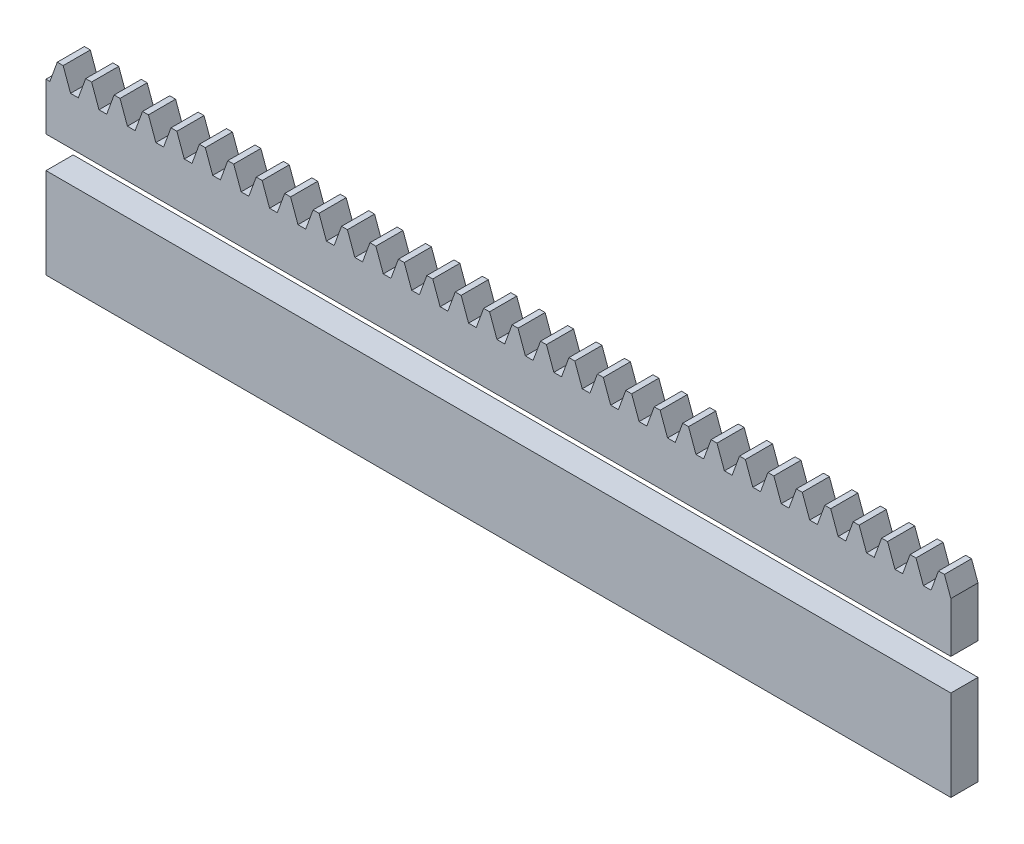
from build123d import *

# Parameters (mm, degrees)
DODANIE_WYCI_GNI_CIE1_DEPTH = 12
WYTNIJ_WYCI_GNI_CIE1_REACH  = 404.592
SZKIC3_W                    = 400
SZKIC3_H                    = 14
SZKIC2_W                    = 400
SZKIC2_H                    = 12
DODANIE_WYCI_GNI_CIE2_DEPTH = 40


with BuildPart() as part:
    # Szkic1 → Dodanie-wyciągnięcie1 (new body)
    with BuildSketch(Plane.XY):
        Polygon((400, 0), (400, 36.15701143), (397.145385613, 44), (394.535962187, 44), (391.260230079, 35), (387.854747121, 35), (384.579015013, 44), (381.969591587, 44), (378.693859479, 35), (375.288376521, 35), (372.012644413, 44), (369.403220987, 44), (366.127488879, 35), (362.722005921, 35), (359.446273813, 44), (356.836850387, 44), (353.561118279, 35), (350.155635321, 35), (346.879903213, 44), (344.270479787, 44), (340.994747679, 35), (337.589264721, 35), (334.313532613, 44), (331.704109187, 44), (328.428377079, 35), (325.022894121, 35), (321.747162013, 44), (319.137738587, 44), (315.862006479, 35), (312.456523521, 35), (309.180791413, 44), (306.571367987, 44), (303.295635879, 35), (299.890152921, 35), (296.614420813, 44), (294.004997387, 44), (290.729265279, 35), (287.323782321, 35), (284.048050213, 44), (281.438626787, 44), (278.162894679, 35), (274.757411721, 35), (271.481679613, 44), (268.872256187, 44), (265.596524079, 35), (262.191041121, 35), (258.915309013, 44), (256.305885587, 44), (253.030153479, 35), (249.624670521, 35), (246.348938413, 44), (243.739514987, 44), (240.463782879, 35), (237.058299921, 35), (233.782567813, 44), (231.173144387, 44), (227.897412279, 35), (224.491929321, 35), (221.216197213, 44), (218.606773787, 44), (215.331041679, 35), (211.925558721, 35), (208.649826613, 44), (206.040403187, 44), (202.764671079, 35), (199.359188121, 35), (196.083456013, 44), (193.474032587, 44), (190.198300479, 35), (186.792817521, 35), (183.517085413, 44), (180.907661987, 44), (177.631929879, 35), (174.226446921, 35), (170.950714813, 44), (168.341291387, 44), (165.065559279, 35), (161.660076321, 35), (158.384344213, 44), (155.774920787, 44), (152.499188679, 35), (149.093705721, 35), (145.817973613, 44), (143.208550187, 44), (139.932818079, 35), (136.527335121, 35), (133.251603013, 44), (130.642179587, 44), (127.366447479, 35), (123.960964521, 35), (120.685232413, 44), (118.075808987, 44), (114.800076879, 35), (111.394593921, 35), (108.118861813, 44), (105.509438387, 44), (102.233706279, 35), (98.828223321, 35), (95.552491213, 44), (92.943067787, 44), (89.667335679, 35), (86.261852721, 35), (82.986120613, 44), (80.376697187, 44), (77.100965079, 35), (73.695482121, 35), (70.419750013, 44), (67.810326587, 44), (64.534594479, 35), (61.129111521, 35), (57.853379413, 44), (55.243955987, 44), (51.968223879, 35), (48.562740921, 35), (45.287008813, 44), (42.677585387, 44), (39.401853279, 35), (35.996370321, 35), (32.720638213, 44), (30.111214787, 44), (26.835482679, 35), (23.429999721, 35), (20.154267613, 44), (17.544844187, 44), (14.269112079, 35), (10.863629121, 35), (7.587897013, 44), (4.978473587, 44), (1.702741479, 35), (0, 35), (0, 0), align=None)
    extrude(amount=DODANIE_WYCI_GNI_CIE1_DEPTH)

    # Szkic3 → Wytnij-wyciągnięcie1 (cut, up to next)
    with BuildSketch(Plane.XY.offset(12), mode=Mode.PRIVATE) as wytnij_wyci_gni_cie1_sk1:
        with Locations((200, 7)):
            Rectangle(SZKIC3_W, SZKIC3_H)
    wytnij_wyci_gni_cie1_tool1 = extrude(wytnij_wyci_gni_cie1_sk1.sketch, amount=-WYTNIJ_WYCI_GNI_CIE1_REACH, mode=Mode.PRIVATE) & part.part
    add(wytnij_wyci_gni_cie1_tool1.solids().sort_by_distance((200, 7, 12))[0], mode=Mode.SUBTRACT)


with BuildPart() as body_2:
    # Szkic2 → Dodanie-wyciągnięcie2 (new body)
    with BuildSketch(Plane.XZ):
        with Locations((200, 6)):
            Rectangle(SZKIC2_W, SZKIC2_H)
    extrude(amount=DODANIE_WYCI_GNI_CIE2_DEPTH)


solid = Compound([part.part, body_2.part])
